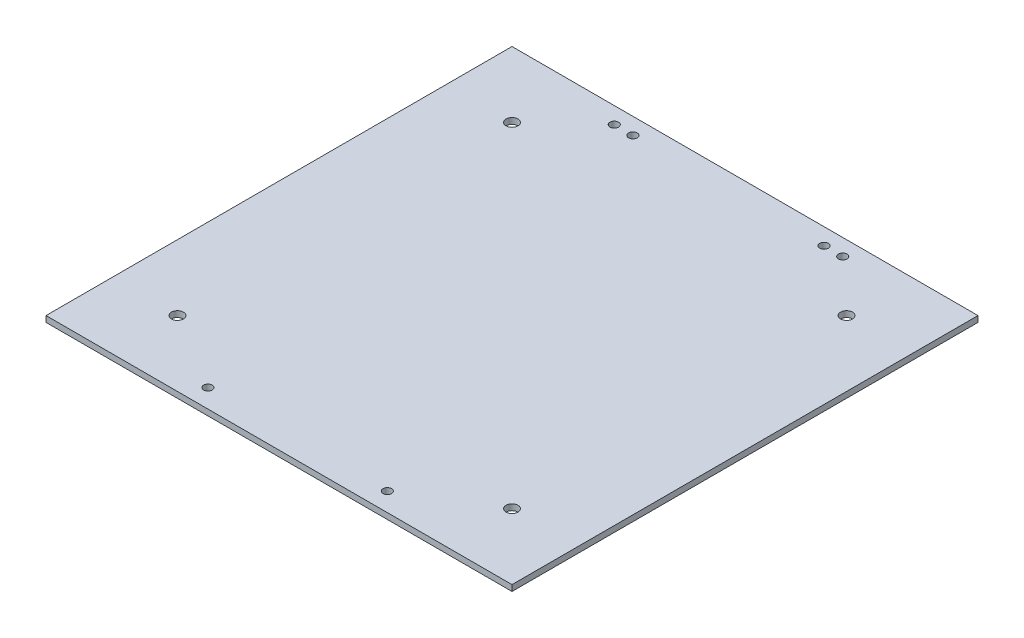
from build123d import *

# Parameters (mm, degrees)
SKETCH1_W           = 247.65
SKETCH1_H           = 247.65
BOSS_EXTRUDE1_DEPTH = 3.175
SKETCH2_R           = 2.286
CUT_EXTRUDE1_DEPTH  = 351.244379862
SKETCH3_R           = 3.175
CUT_EXTRUDE2_DEPTH  = 351.244379862


with BuildPart() as part:
    # Sketch1 → Boss-Extrude1 (new body)
    with BuildSketch(Plane(origin=(0, 0, 0), x_dir=(1, 0, 0), z_dir=(0, 1, 0))):
        with Locations((123.825, 123.825)):
            Rectangle(SKETCH1_W, SKETCH1_H)
    extrude(amount=BOSS_EXTRUDE1_DEPTH)

    # Sketch2 → Cut-Extrude1 (cut, through all)
    with BuildSketch(Plane(origin=(0, 3.175, 0), x_dir=(1, 0, 0), z_dir=(0, 1, 0))):
        with Locations((63.119, 238.8616)):
            Circle(SKETCH2_R)
        with Locations((73.025, 238.8616)):
            Circle(SKETCH2_R)
        with Locations((174.625, 238.8616)):
            Circle(SKETCH2_R)
        with Locations((184.531, 238.8616)):
            Circle(SKETCH2_R)
        with Locations((76.15682, 9.906)):
            Circle(SKETCH2_R)
        with Locations((171.49318, 9.906)):
            Circle(SKETCH2_R)
    extrude(amount=-CUT_EXTRUDE1_DEPTH, mode=Mode.SUBTRACT)

    # Sketch3 → Cut-Extrude2 (cut, through all)
    with BuildSketch(Plane(origin=(0, 3.175, 0), x_dir=(1, 0, 0), z_dir=(0, 1, 0))):
        with Locations((212.725, 212.725)):
            Circle(SKETCH3_R)
        with Locations((212.725, 34.925)):
            Circle(SKETCH3_R)
        with Locations((34.925, 34.925)):
            Circle(SKETCH3_R)
        with Locations((34.925, 212.725)):
            Circle(SKETCH3_R)
    extrude(amount=-CUT_EXTRUDE2_DEPTH, mode=Mode.SUBTRACT)


solid = part.part
